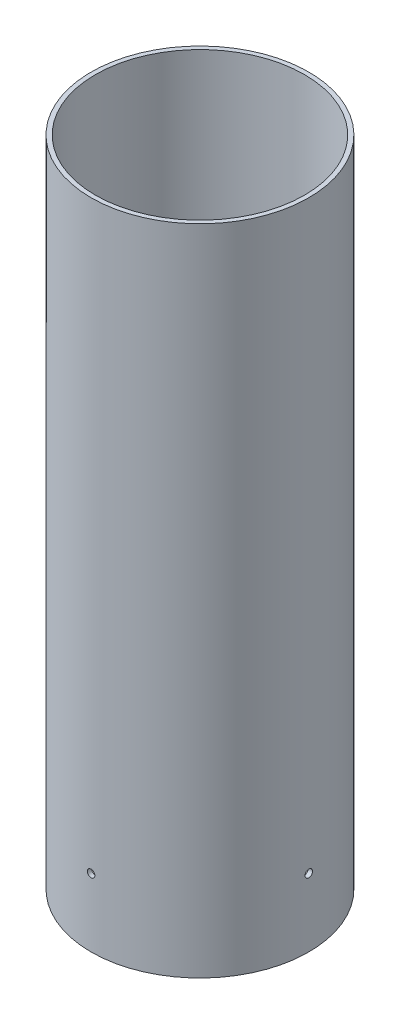
from build123d import *

# Parameters (mm, degrees)
SKETCH2_R               = 50.8
SKETCH2_R_2             = 48.768
COUPLER_EXTRUSION_DEPTH = 304.8
BULKHEAD_HOLES_REACH    = 327.279
SKETCH3_R               = 1.7526
CIRPATTERN1_COUNT       = 4


with BuildPart() as part:
    # Sketch2 → Coupler Extrusion (new body)
    with BuildSketch(Plane(origin=(0, 0, 0), x_dir=(1, 0, 0), z_dir=(0, 1, 0))):
        Circle(SKETCH2_R)
        Circle(SKETCH2_R_2, mode=Mode.SUBTRACT)
    extrude(amount=COUPLER_EXTRUSION_DEPTH)

    # Sketch3 → Bulkhead Holes (cut, up to next)
    with BuildSketch(Plane.XY.offset(50.8), mode=Mode.PRIVATE) as bulkhead_holes_sk1:
        with Locations((0, 31.75)):
            Circle(SKETCH3_R)
    bulkhead_holes_tool1 = extrude(bulkhead_holes_sk1.sketch, amount=-BULKHEAD_HOLES_REACH, mode=Mode.PRIVATE) & part.part
    bulkhead_holes = bulkhead_holes_tool1.solids().sort_by_distance((0, 31.75, 50.8))[0]
    add(bulkhead_holes, mode=Mode.SUBTRACT)

    # CirPattern1: Bulkhead Holes ×4 about axis
    cirpattern1_axis = Axis((0, 304.8, 0), (0, -1, 0))
    for i in range(1, CIRPATTERN1_COUNT):
        add(bulkhead_holes.rotate(cirpattern1_axis, i * 360 / CIRPATTERN1_COUNT), mode=Mode.SUBTRACT)


solid = part.part
